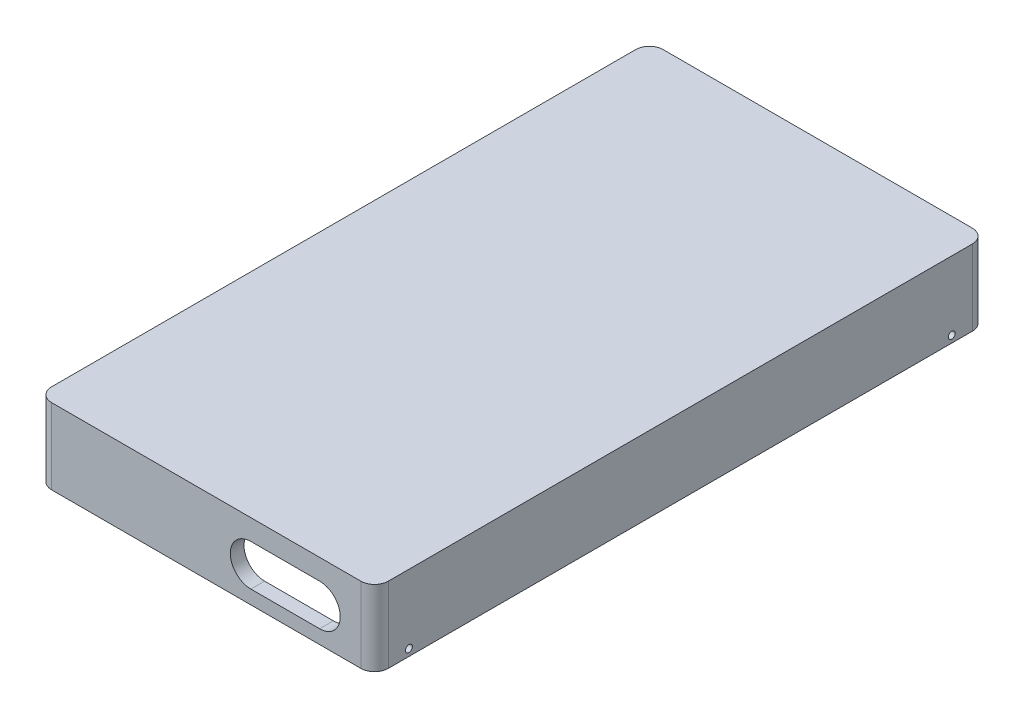
from build123d import *

# Parameters (mm, degrees)
SKETCH1_W           = 57.15
SKETCH1_H           = 107.95
BOSS_EXTRUDE1_DEPTH = 2.54
SKETCH2_W           = 62.23
SKETCH2_H           = 113.03
SKETCH2_W_2         = 57.15
SKETCH2_H_2         = 107.95
BOSS_EXTRUDE3_DEPTH = 13.97
CUT_EXTRUDE1_DEPTH  = 10.16
FILLET1_R           = 2.54
SKETCH4_R           = 0.635
CUT_EXTRUDE2_DEPTH  = 128.323438141


with BuildPart() as part:
    # Sketch1 → Boss-Extrude1 (new body)
    with BuildSketch(Plane(origin=(0, 0, 0), x_dir=(1, 0, 0), z_dir=(0, 1, 0))):
        with Locations((28.575, 53.975)):
            Rectangle(SKETCH1_W, SKETCH1_H)
    extrude(amount=BOSS_EXTRUDE1_DEPTH)

    # Sketch2 → Boss-Extrude3 (add)
    with BuildSketch(Plane(origin=(0, 2.54, 0), x_dir=(1, 0, 0), z_dir=(0, 1, 0))):
        with Locations((28.575, 53.975)):
            Rectangle(SKETCH2_W, SKETCH2_H)
        with Locations((28.575, 53.975)):
            Rectangle(SKETCH2_W_2, SKETCH2_H_2, mode=Mode.SUBTRACT)
    extrude(amount=-BOSS_EXTRUDE3_DEPTH)

    # Sketch3 → Cut-Extrude1 (cut)
    with BuildSketch(Plane.XY.offset(2.54)):
        with BuildLine():
            Line((36.83, -1.27), (49.53, -1.27))
            ThreePointArc((49.53, -1.27), (53.34, -5.08), (49.53, -8.89))
            Line((49.53, -8.89), (36.83, -8.89))
            ThreePointArc((36.83, -8.89), (33.02, -5.08), (36.83, -1.27))
        make_face()
    extrude(amount=-CUT_EXTRUDE1_DEPTH, mode=Mode.SUBTRACT)

    # Fillet1
    fillet1_edges = [part.edges().sort_by_distance(p)[0] for p in [
        (-2.54, -4.445, -110.49),
        (59.69, -4.445, -110.49),
        (59.69, -4.445, 2.54),
        (-2.54, -4.445, 2.54),
    ]]
    fillet(fillet1_edges, radius=FILLET1_R)

    # Sketch4 → Cut-Extrude2 (cut, through all)
    with BuildSketch(Plane.ZY.offset(2.54)):
        with Locations((-104.14, -10.16)):
            Circle(SKETCH4_R)
        with Locations((-3.81, -10.16)):
            Circle(SKETCH4_R)
    extrude(amount=-CUT_EXTRUDE2_DEPTH, mode=Mode.SUBTRACT)


solid = part.part
